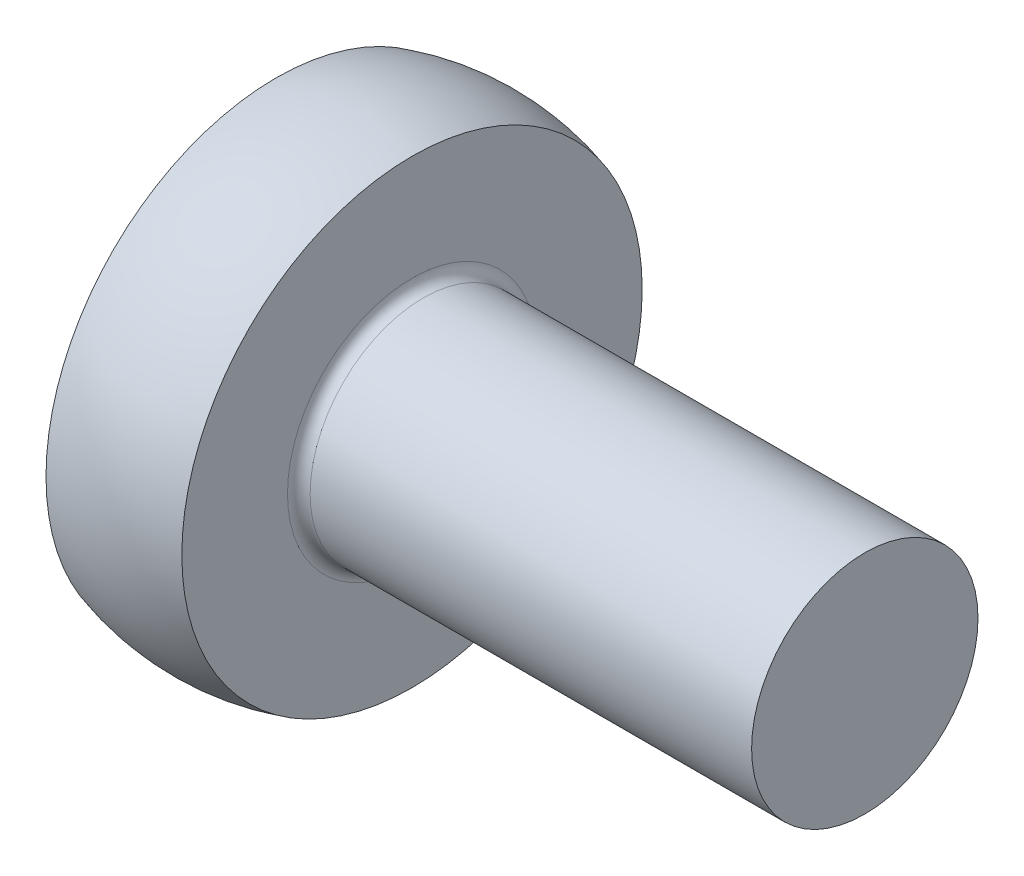
from build123d import *

# Parameters (mm, degrees)
FILLET1_R = 0.1


with BuildPart() as part:
    # Sketch1 → Base-Revolve (revolve)
    with BuildSketch(Plane.XY):
        with BuildLine():
            Line((0, 2.033322404), (0, 0))
            Line((0, 0), (5.2, 0))
            Line((5.2, 0), (5.2, 1))
            Line((5.2, 1), (1.2, 1))
            Line((1.2, 1), (1.2, 2.033322404))
            ThreePointArc((1.2, 2.033322404), (0.6, 2.12), (0, 2.033322404))
        make_face()
    revolve(axis=Axis((-2.318253968, 0, 0), (1, 0, 0)))

    # Fillet1
    fillet1_edges = [part.edges().sort_by_distance(p)[0] for p in [
        (1.2, -1, 0),
    ]]
    fillet(fillet1_edges, radius=FILLET1_R)


solid = part.part
